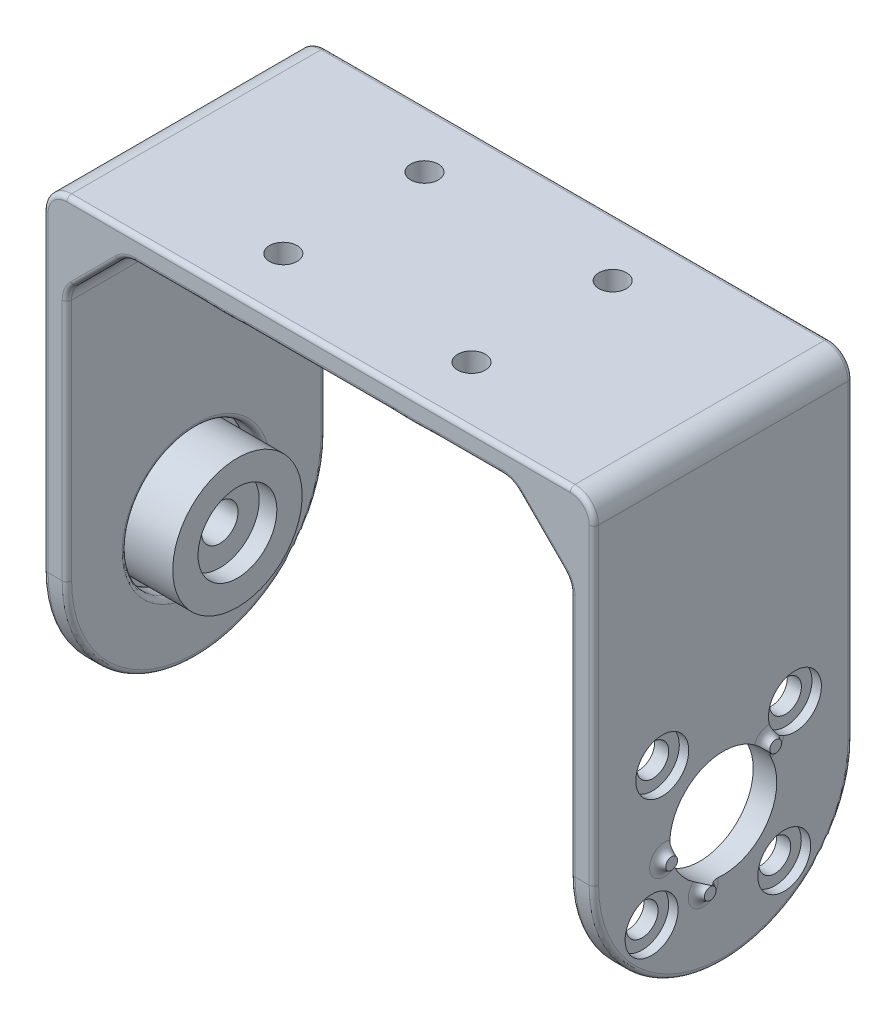
from build123d import *

# Parameters (mm, degrees)
BOSS_EXTRUDE1_DEPTH    = 11
CUT_EXTRUDE1_START     = -46.8
CUT_EXTRUDE1_OUTLINE_R = 4.55
CUT_EXTRUDE1_DEPTH     = 46.8
FILLET2_R              = 2
SKETCH3_R              = 1.175
CUT_EXTRUDE2_DEPTH     = 48.210274305
SKETCH4_R              = 3.175
SKETCH4_R_2            = 1.175
BOSS_EXTRUDE2_DEPTH    = 1.5
SKETCH5_R              = 5.5
SKETCH5_R_2            = 3.35
BOSS_EXTRUDE5_DEPTH    = 5.5
SKETCH6_R              = 3.35
SKETCH6_R_2            = 1.55
BOSS_EXTRUDE6_DEPTH    = 4
SKETCH8_R              = 2.7
CUT_EXTRUDE3_DEPTH     = 1.1
FILLET4_R              = 2
CHAMFER1_SIZE          = 5
FILLET12_R             = 2
FILLET5_R              = 1
FILLET6_R              = 0.4
CUT_EXTRUDE4_REACH     = 57.888
SKETCH9_R              = 1.35
SKETCH10_R             = 0.5
BOSS_EXTRUDE7_DEPTH    = 0.6
SKETCH11_R             = 2.25
CUT_EXTRUDE5_DEPTH     = 0.8
FILLET9_R              = 0.8
SKETCH12_R             = 5.9
SKETCH12_R_2           = 5.5
CUT_EXTRUDE6_DEPTH     = 55.721202575
SKETCH13_R             = 7.5
SKETCH13_R_2           = 2.7
BOSS_EXTRUDE8_DEPTH    = 2
FILLET10_R             = 0.4
FILLET13_R             = 0.4


with BuildPart() as part:
    # Sketch1 → Boss-Extrude1 (new, symmetric)
    with BuildSketch(Plane.XY):
        Polygon((-23.4, 28.5), (-23.4, -11), (-21.4, -11), (-21.4, 26.5), (21.4, 26.5), (21.4, -11), (23.4, -11), (23.4, 28.5), align=None)
    extrude(amount=BOSS_EXTRUDE1_DEPTH, both=True)

    # Cut-Extrude1: read off the stored shape, not the designer's step
    # Cut-Extrude1 outline → Cut-Extrude1 (cut)
    with BuildSketch(Plane(origin=(23.4, 0, 0), x_dir=(0, 0, -1), z_dir=(1, 0, 0)).offset(CUT_EXTRUDE1_START)):
        with BuildLine():
            ThreePointArc((11, 0), (7.778174593, -7.778174593), (0, -11))
            Line((0, -11), (11, -11))
            Line((11, -11), (11, 0))
        make_face()
        with BuildLine():
            ThreePointArc((0, -11), (-7.778174593, -7.778174593), (-11, 0))
            Line((-11, 0), (-11, -11))
            Line((-11, -11), (0, -11))
        make_face()
        Circle(CUT_EXTRUDE1_OUTLINE_R)
    extrude(amount=CUT_EXTRUDE1_DEPTH, mode=Mode.SUBTRACT)

    # Fillet2
    fillet2_edges = [part.edges().sort_by_distance(p)[0] for p in [
        (-23.4, 28.5, 0),
        (23.4, 28.5, 0),
    ]]
    fillet(fillet2_edges, radius=FILLET2_R)

    # Sketch3 → Cut-Extrude2 (cut, through all)
    with BuildSketch(Plane(origin=(0, 28.5, 0), x_dir=(1, 0, 0), z_dir=(0, 1, 0))):
        with Locations(Location((8, -6, 0), (0, 0, 270))):
            Circle(SKETCH3_R)
        with Locations(Location((-8, -6, 0), (0, 0, 270))):
            Circle(SKETCH3_R)
        with Locations(Location((8, 6, 0), (0, 0, 270))):
            Circle(SKETCH3_R)
        with Locations(Location((-8, 6, 0), (0, 0, 270))):
            Circle(SKETCH3_R)
    extrude(amount=-CUT_EXTRUDE2_DEPTH, mode=Mode.SUBTRACT)

    # Sketch4 → Boss-Extrude2 (add)
    # profile 1 of 4: a face of its own
    with BuildSketch(Plane.XZ.offset(-26.5)):
        with Locations(Location((8, -6, 0), (0, 0, 90))):
            Circle(SKETCH4_R)
        with Locations(Location((8, -6, 0), (0, 0, 90))):
            Circle(SKETCH4_R_2, mode=Mode.SUBTRACT)
    # profile 2 of 4: a face of its own
    with BuildSketch(Plane.XZ.offset(-26.5)):
        with Locations(Location((-8, -6, 0), (0, 0, 90))):
            Circle(SKETCH4_R)
        with Locations(Location((-8, -6, 0), (0, 0, 90))):
            Circle(SKETCH4_R_2, mode=Mode.SUBTRACT)
    # profile 3 of 4: a face of its own
    with BuildSketch(Plane.XZ.offset(-26.5)):
        with Locations(Location((-8, 6, 0), (0, 0, 90))):
            Circle(SKETCH4_R)
        with Locations(Location((-8, 6, 0), (0, 0, 90))):
            Circle(SKETCH4_R_2, mode=Mode.SUBTRACT)
    # profile 4 of 4: a face of its own
    with BuildSketch(Plane.XZ.offset(-26.5)):
        with Locations(Location((8, 6, 0), (0, 0, 90))):
            Circle(SKETCH4_R)
        with Locations(Location((8, 6, 0), (0, 0, 90))):
            Circle(SKETCH4_R_2, mode=Mode.SUBTRACT)
    extrude(amount=BOSS_EXTRUDE2_DEPTH)

    # Sketch5 → Boss-Extrude5 (add)
    with BuildSketch(Plane(origin=(-23.4, 0, 0), x_dir=(0, 0, -1), z_dir=(1, 0, 0))):
        with Locations(Location((0, 0, 0), (0, 0, 270))):
            Circle(SKETCH5_R)
        with Locations(Location((0, 0, 0), (0, 0, 270))):
            Circle(SKETCH5_R_2, mode=Mode.SUBTRACT)
    extrude(amount=BOSS_EXTRUDE5_DEPTH)

    # Sketch6 → Boss-Extrude6 (add)
    with BuildSketch(Plane.ZY.offset(23.4)):
        with Locations(Location((0, 0, 0), (0, 0, 270))):
            Circle(SKETCH6_R)
        with Locations(Location((0, 0, 0), (0, 0, 270))):
            Circle(SKETCH6_R_2, mode=Mode.SUBTRACT)
    extrude(amount=-BOSS_EXTRUDE6_DEPTH)

    # Sketch8 → Cut-Extrude3 (cut)
    with BuildSketch(Plane.ZY.offset(23.4)):
        with Locations(Location((0, 0, 0), (0, 0, 270))):
            Circle(SKETCH8_R)
    extrude(amount=-CUT_EXTRUDE3_DEPTH, mode=Mode.SUBTRACT)

    # Fillet4
    # the kernel refuses this fillet: 2 mm, written as the material it adds along each edge
    with BuildSketch(Plane(origin=(8, 26.5, -6), x_dir=(0, 0, 1), z_dir=(1, 0, 0))) as fillet4_piece_1_section:
        with BuildLine():
            CenterArc((5.111491673, 2), FILLET4_R, 194.477512186, 75.522487814)
            Line((3.175, 1.5), (3.175, 0))
            Line((3.175, 0), (5.111491673, 0))
        make_face()
    fillet4_piece_1 = revolve(axis=Axis((8, 26.5, -6), (0, -1, 0)), mode=Mode.PRIVATE)
    fillet4_piece_1 = split(fillet4_piece_1, bisect_by=Plane(origin=(8, 26.5, -11), z_dir=(0, 0, 1)), keep=Keep.TOP, mode=Mode.PRIVATE)
    add(fillet4_piece_1)
    with BuildSketch(Plane(origin=(-8, 26.5, -6), x_dir=(0, 0, 1), z_dir=(1, 0, 0))) as fillet4_piece_2_section:
        with BuildLine():
            CenterArc((5.111491673, 2), FILLET4_R, 194.477512186, 75.522487814)
            Line((3.175, 1.5), (3.175, 0))
            Line((3.175, 0), (5.111491673, 0))
        make_face()
    fillet4_piece_2 = revolve(axis=Axis((-8, 26.5, -6), (0, -1, 0)), mode=Mode.PRIVATE)
    fillet4_piece_2 = split(fillet4_piece_2, bisect_by=Plane(origin=(-8, 26.5, -11), z_dir=(0, 0, 1)), keep=Keep.TOP, mode=Mode.PRIVATE)
    add(fillet4_piece_2)
    with BuildSketch(Plane(origin=(-8, 26.5, 6), x_dir=(0, 0, 1), z_dir=(1, 0, 0))) as fillet4_piece_3_section:
        with BuildLine():
            CenterArc((5.111491673, 2), FILLET4_R, 194.477512186, 75.522487814)
            Line((3.175, 1.5), (3.175, 0))
            Line((3.175, 0), (5.111491673, 0))
        make_face()
    fillet4_piece_3 = revolve(axis=Axis((-8, 26.5, 6), (0, -1, 0)), mode=Mode.PRIVATE)
    fillet4_piece_3 = split(fillet4_piece_3, bisect_by=Plane(origin=(-8, 26.5, 11), z_dir=(0, 0, -1)), keep=Keep.TOP, mode=Mode.PRIVATE)
    add(fillet4_piece_3)
    with BuildSketch(Plane(origin=(8, 26.5, 6), x_dir=(0, 0, 1), z_dir=(1, 0, 0))) as fillet4_piece_4_section:
        with BuildLine():
            CenterArc((5.111491673, 2), FILLET4_R, 194.477512186, 75.522487814)
            Line((3.175, 1.5), (3.175, 0))
            Line((3.175, 0), (5.111491673, 0))
        make_face()
    fillet4_piece_4 = revolve(axis=Axis((8, 26.5, 6), (0, -1, 0)), mode=Mode.PRIVATE)
    fillet4_piece_4 = split(fillet4_piece_4, bisect_by=Plane(origin=(8, 26.5, 11), z_dir=(0, 0, -1)), keep=Keep.TOP, mode=Mode.PRIVATE)
    add(fillet4_piece_4)

    # Chamfer1
    chamfer1_edges = [part.edges().sort_by_distance(p)[0] for p in [
        (21.4, 26.5, 0),
        (-21.4, 26.5, 0),
    ]]
    chamfer(chamfer1_edges, length=CHAMFER1_SIZE)

    # Fillet12
    fillet12_edges = [part.edges().sort_by_distance(p)[0] for p in [
        (16.4, 26.5, 0),
        (-16.4, 26.5, 0),
        (-21.4, 21.5, 0),
        (21.4, 21.5, 0),
    ]]
    fillet(fillet12_edges, radius=FILLET12_R)

    # Fillet5
    fillet5_edges = [part.edges().sort_by_distance(p)[0] for p in [
        (8, 25, -9.175),
        (-8, 25, -9.175),
        (-8, 25, 2.825),
        (8, 25, 2.825),
    ]]
    fillet(fillet5_edges, radius=FILLET5_R)

    # Fillet6
    fillet6_edges = [part.edges().sort_by_distance(p)[0] for p in [
        (0, 26.5, -11),
        (12.316669458, 26.5, -11),
        (0, 26.5, 11),
        (12.316669458, 26.5, 11),
        (-8, 26.496889983, -11),
        (-8.530883559, 26.498260901, 11),
        (8.530883559, 26.498260901, 11),
        (8, 26.496889983, -11),
        (-18.9, 24, 11),
        (-18.9, 24, -11),
        (-12.316669458, 26.5, 11),
        (-12.316669458, 26.5, -11),
        (18.9, 24, 11),
        (18.9, 24, -11),
        (21.4, 10.335786438, 11),
        (21.4, 10.335786438, -11),
        (-21.247759065, 21.43693974, 11),
        (-21.247759065, 21.43693974, -11),
        (-16.33693974, 26.347759065, -11),
        (-16.33693974, 26.347759065, 11),
        (16.33693974, 26.347759065, 11),
        (16.33693974, 26.347759065, -11),
        (21.247759065, 21.43693974, -11),
        (21.247759065, 21.43693974, 11),
        (-21.4, 10.335786438, 11),
        (23.4, 13.25, 11),
        (23.4, -7.778174593, -7.778174593),
        (-21.4, -7.778174593, -7.778174593),
        (21.4, -7.778174593, 7.778174593),
        (-23.4, -7.778174593, 7.778174593),
        (-21.4, 10.335786438, -11),
        (23.4, 13.25, -11),
        (0, 28.5, -11),
        (0, 28.5, 11),
        (-23.4, 13.25, -11),
        (-22.814213562, 27.914213562, -11),
        (22.814213562, 27.914213562, -11),
        (-23.4, 13.25, 11),
        (-22.814213562, 27.914213562, 11),
        (22.814213562, 27.914213562, 11),
    ]]
    fillet(fillet6_edges, radius=FILLET6_R)

    # Sketch9 → Cut-Extrude4 (cut, up to next)
    with BuildSketch(Plane(origin=(23.4, 0, 0), x_dir=(0, 0, -1), z_dir=(1, 0, 0)), mode=Mode.PRIVATE) as cut_extrude4_sk1:
        with Locations(Location((6.092867773, 5.184299596, 0), (0, 0, 90))):
            Circle(SKETCH9_R)
    cut_extrude4_tool1 = extrude(cut_extrude4_sk1.sketch, amount=-CUT_EXTRUDE4_REACH, mode=Mode.PRIVATE) & part.part
    # Sketch9 → Cut-Extrude4 (cut, up to next)
    with BuildSketch(Plane(origin=(23.4, 0, 0), x_dir=(0, 0, -1), z_dir=(1, 0, 0)), mode=Mode.PRIVATE) as cut_extrude4_sk2:
        with Locations(Location((-5.184299596, 6.092867773, 0), (0, 0, 90))):
            Circle(SKETCH9_R)
    cut_extrude4_tool2 = extrude(cut_extrude4_sk2.sketch, amount=-CUT_EXTRUDE4_REACH, mode=Mode.PRIVATE) & part.part
    # Sketch9 → Cut-Extrude4 (cut, up to next)
    with BuildSketch(Plane(origin=(23.4, 0, 0), x_dir=(0, 0, -1), z_dir=(1, 0, 0)), mode=Mode.PRIVATE) as cut_extrude4_sk3:
        with Locations(Location((-6.092867773, -5.184299596, 0), (0, 0, 90))):
            Circle(SKETCH9_R)
    cut_extrude4_tool3 = extrude(cut_extrude4_sk3.sketch, amount=-CUT_EXTRUDE4_REACH, mode=Mode.PRIVATE) & part.part
    # Sketch9 → Cut-Extrude4 (cut, up to next)
    with BuildSketch(Plane(origin=(23.4, 0, 0), x_dir=(0, 0, -1), z_dir=(1, 0, 0)), mode=Mode.PRIVATE) as cut_extrude4_sk4:
        with Locations(Location((5.184299596, -6.092867773, 0), (0, 0, 90))):
            Circle(SKETCH9_R)
    cut_extrude4_tool4 = extrude(cut_extrude4_sk4.sketch, amount=-CUT_EXTRUDE4_REACH, mode=Mode.PRIVATE) & part.part
    add(cut_extrude4_tool1.solids().sort_by_distance((23.4, 5.1843, -6.092868))[0], mode=Mode.SUBTRACT)
    add(cut_extrude4_tool2.solids().sort_by_distance((23.4, 6.092868, 5.1843))[0], mode=Mode.SUBTRACT)
    add(cut_extrude4_tool3.solids().sort_by_distance((23.4, -5.1843, 6.092868))[0], mode=Mode.SUBTRACT)
    add(cut_extrude4_tool4.solids().sort_by_distance((23.4, -6.092868, -5.1843))[0], mode=Mode.SUBTRACT)

    # Sketch10 → Boss-Extrude7 (add)
    with BuildSketch(Plane(origin=(23.4, 0, 0), x_dir=(0, 0, -1), z_dir=(1, 0, 0))):
        with Locations(Location((-4.987189931, -0.914762522, 0), (0, 0, 270))):
            Circle(SKETCH10_R)
        with Locations(Location((-1.701387384, -4.776414435, 0), (0, 0, 270))):
            Circle(SKETCH10_R)
        with Locations(Location((3.861651913, 3.285802548, 0), (0, 0, 270))):
            Circle(SKETCH10_R)
    extrude(amount=BOSS_EXTRUDE7_DEPTH)

    # Sketch11 → Cut-Extrude5 (cut)
    with BuildSketch(Plane(origin=(23.4, 0, 0), x_dir=(0, 0, -1), z_dir=(1, 0, 0))):
        with Locations(Location((6.092867773, 5.184299596, 0), (0, 0, 90))):
            Circle(SKETCH11_R)
        with Locations(Location((-5.184299596, 6.092867773, 0), (0, 0, 90))):
            Circle(SKETCH11_R)
        with Locations(Location((5.184299596, -6.092867773, 0), (0, 0, 90))):
            Circle(SKETCH11_R)
        with Locations(Location((-6.092867773, -5.184299596, 0), (0, 0, 90))):
            Circle(SKETCH11_R)
    extrude(amount=-CUT_EXTRUDE5_DEPTH, mode=Mode.SUBTRACT)

    # Fillet9
    # the kernel refuses this fillet: 0.8 mm, written as the material it adds along each edge
    with BuildSketch(Plane(origin=(23.4, -0.914762522, 4.987189931), x_dir=(0, -1, 0), z_dir=(0, 0, 1))) as fillet9_piece_1_section:
        with BuildLine():
            CenterArc((1.274596669, 0.8), FILLET9_R, 194.477512186, 75.522487814)
            Line((0.5, 0.6), (0.5, 0))
            Line((0.5, 0), (1.274596669, 0))
        make_face()
    fillet9_piece_1 = revolve(axis=Axis((23.4, -0.914762522, 4.987189931), (1, 0, 0)), mode=Mode.PRIVATE)
    fillet9_piece_1 = fillet9_piece_1 - Plane(origin=(23.4, 0, 0), x_dir=(0, 0, -1), z_dir=(-1, 0, 0)) * Cylinder(4.55, 6, mode=Mode.PRIVATE)
    add(fillet9_piece_1)
    with BuildSketch(Plane(origin=(23.4, -4.776414435, 1.701387384), x_dir=(0, -1, 0), z_dir=(0, 0, 1))) as fillet9_piece_2_section:
        with BuildLine():
            CenterArc((1.274596669, 0.8), FILLET9_R, 194.477512186, 75.522487814)
            Line((0.5, 0.6), (0.5, 0))
            Line((0.5, 0), (1.274596669, 0))
        make_face()
    fillet9_piece_2 = revolve(axis=Axis((23.4, -4.776414435, 1.701387384), (1, 0, 0)), mode=Mode.PRIVATE)
    fillet9_piece_2 = fillet9_piece_2 - Plane(origin=(23.4, 0, 0), x_dir=(0, 0, -1), z_dir=(-1, 0, 0)) * Cylinder(4.55, 6, mode=Mode.PRIVATE)
    add(fillet9_piece_2)
    with BuildSketch(Plane(origin=(23.4, 3.285802548, -3.861651913), x_dir=(0, -1, 0), z_dir=(0, 0, 1))) as fillet9_piece_3_section:
        with BuildLine():
            CenterArc((1.274596669, 0.8), FILLET9_R, 194.477512186, 75.522487814)
            Line((0.5, 0.6), (0.5, 0))
            Line((0.5, 0), (1.274596669, 0))
        make_face()
    fillet9_piece_3 = revolve(axis=Axis((23.4, 3.285802548, -3.861651913), (1, 0, 0)), mode=Mode.PRIVATE)
    fillet9_piece_3 = fillet9_piece_3 - Plane(origin=(23.4, 5.184299596, -6.092867773), x_dir=(0, 1, 0), z_dir=(1, 0, 0)) * Cylinder(2.25, 6, mode=Mode.PRIVATE)
    fillet9_piece_3 = fillet9_piece_3 - Plane(origin=(23.4, 0, 0), x_dir=(0, 0, -1), z_dir=(-1, 0, 0)) * Cylinder(4.55, 6, mode=Mode.PRIVATE)
    add(fillet9_piece_3)

    # Sketch12 → Cut-Extrude6 (cut, through all)
    with BuildSketch(Plane(origin=(-21.4, 0, 0), x_dir=(0, 0, -1), z_dir=(1, 0, 0))):
        with Locations(Location((0, 0, 0), (0, 0, 90))):
            Circle(SKETCH12_R)
        with Locations(Location((0, 0, 0), (0, 0, 270))):
            Circle(SKETCH12_R_2, mode=Mode.SUBTRACT)
    extrude(amount=-CUT_EXTRUDE6_DEPTH, mode=Mode.SUBTRACT)


with BuildPart() as cut_extrude6_piece_1:
    # of the separate pieces the step leaves, piece 1, a body of its own (cut_extrude6_pieces)
    add(part.part.solids().sort_by_distance((24, 2.785802548, -3.861651913))[0])

    # Fillet13
    fillet13_edges = [cut_extrude6_piece_1.edges().sort_by_distance(p)[0] for p in [
        (-21.4, -5.9, 0),
        (-23.4, -5.9, 0),
    ]]
    fillet(fillet13_edges, radius=FILLET13_R)


with BuildPart() as cut_extrude6_piece_2:
    # of the separate pieces the step leaves, piece 2, a body of its own (cut_extrude6_pieces)
    add(part.part.solids().sort_by_distance((-23.4, -5.5, 0))[0])

    # Sketch13 → Boss-Extrude8 (add)
    with BuildSketch(Plane.ZY.offset(23.4)):
        with Locations(Location((0, 0, 0), (0, 0, 270))):
            Circle(SKETCH13_R)
        with Locations(Location((0, 0, 0), (0, 0, 270))):
            Circle(SKETCH13_R_2, mode=Mode.SUBTRACT)
    extrude(amount=BOSS_EXTRUDE8_DEPTH)

    # Fillet10
    fillet10_edges = [cut_extrude6_piece_2.edges().sort_by_distance(p)[0] for p in [
        (-25.4, 7.5, 0),
        (-23.4, 7.5, 0),
    ]]
    fillet(fillet10_edges, radius=FILLET10_R)


solid = Compound([cut_extrude6_piece_1.part, cut_extrude6_piece_2.part])
